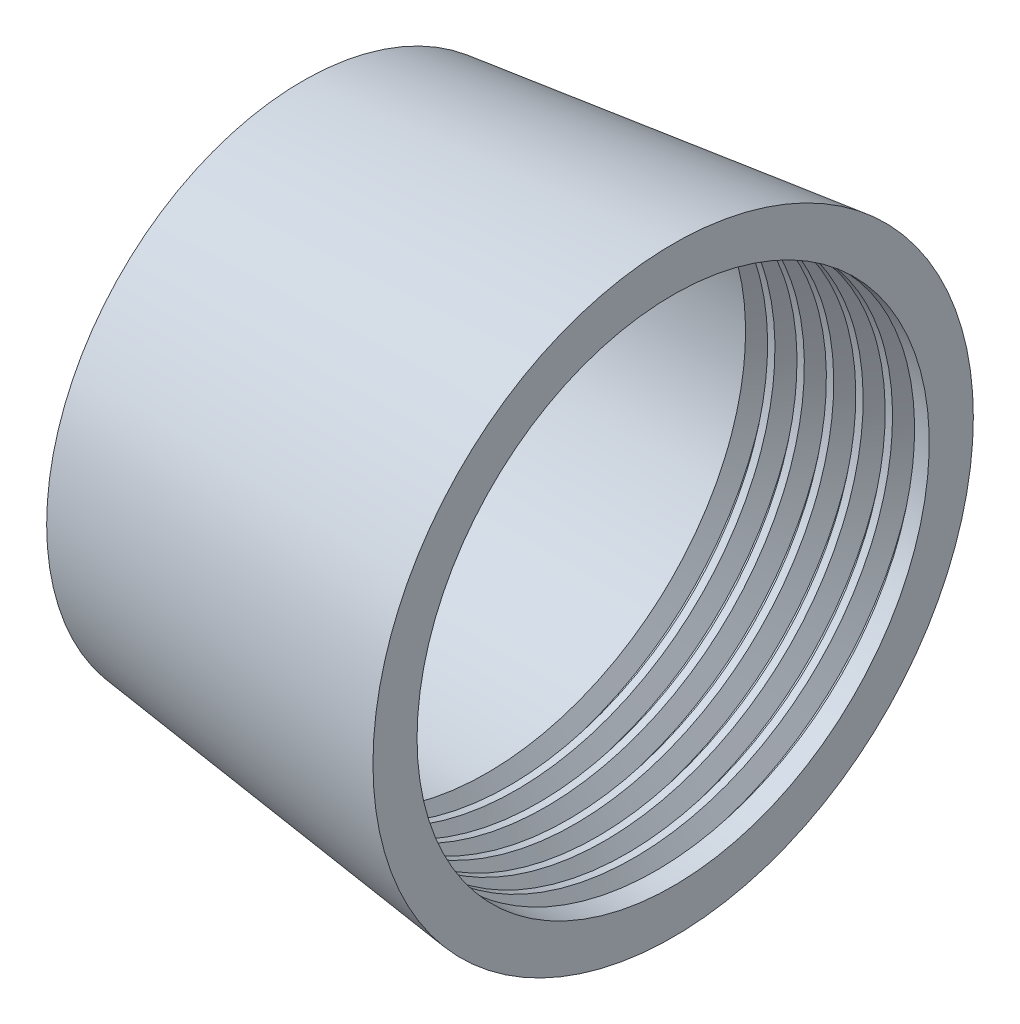
from build123d import *

# Parameters (mm, degrees)
THREAD1_PITCH = 2.116666667


with BuildPart() as part:
    # Sketch1 → Revolve1 (revolve)
    with BuildSketch(Plane.XY, mode=Mode.PRIVATE) as revolve1_sk:
        Polygon((26.67, 21.6154), (0, 18.4404), (26.67, 18.4404), align=None)
    revolve(revolve1_sk.sketch.rotate(Axis((0, 0, 0), (1, 0, 0)), 90), axis=Axis((0, 0, 0), (1, 0, 0)))

    # Thread1: the profile of Thread Profile1 profile screwed along a right-hand helix of 6 turns, 10 arcs to a turn; built about Z, then put on its axis
    thread1_z = Axis((0, 0, 0), (0, 0, 1))
    thread1_corners = [(18.4401, 0, -0.000173205), (19.586079435, 0, 0.66145833), (19.586079435, 0, 0.926041664), (18.4401, 0, 1.587673199)]
    with BuildLine(mode=Mode.PRIVATE) as thread1_profile:
        Line(thread1_corners[0], thread1_corners[1])
        Line(thread1_corners[1], thread1_corners[2])
        Line(thread1_corners[2], thread1_corners[3])
        Line(thread1_corners[3], thread1_corners[0])
    thread1_cap = Face(thread1_profile.wire())
    thread1_turn_angles = [0, 18, 36, 54, 72, 90, 108, 126, 144, 162, 180, 198, 216, 234, 252, 270, 288, 306, 324, 342, 360]
    thread1_turn_weights = [1, 0.9510565162951535, 1, 0.9510565162951535, 1, 0.9510565162951535, 1, 0.9510565162951535, 1, 0.9510565162951535, 1, 0.9510565162951535, 1, 0.9510565162951535, 1, 0.9510565162951535, 1, 0.9510565162951535, 1, 0.9510565162951535, 1]
    thread1_turn_rails = [Edge.make_bspline([Vector(p[0], p[1], 0).rotate(thread1_z, thread1_turn_angles[k]) / thread1_turn_weights[k] + Vector(0, 0, p[2] + THREAD1_PITCH * thread1_turn_angles[k] / 360) for k in range(21)], [0, 0, 0, 1, 1, 2, 2, 3, 3, 4, 4, 5, 5, 6, 6, 7, 7, 8, 8, 9, 9, 10, 10, 10], 2, thread1_turn_weights) for p in thread1_corners]
    thread1_turn_sides = [Face.make_surface_from_curves(thread1_turn_rails[p[0]], thread1_turn_rails[p[1]]) for p in [(0, 1), (1, 2), (2, 3), (3, 0)]]
    thread1 = Plane(origin=(26.67, 0, 0), x_dir=(0, 0, 1), z_dir=(-1, 0, 0)) * Solid(Shell([*[p.moved(Location((0, 0, THREAD1_PITCH * i))) for i in range(6) for p in thread1_turn_sides], thread1_cap, thread1_cap.rotate(thread1_z, 2160).moved(Location((0, 0, THREAD1_PITCH * 2160 / 360)))]))
    add(thread1, mode=Mode.SUBTRACT)


solid = part.part
